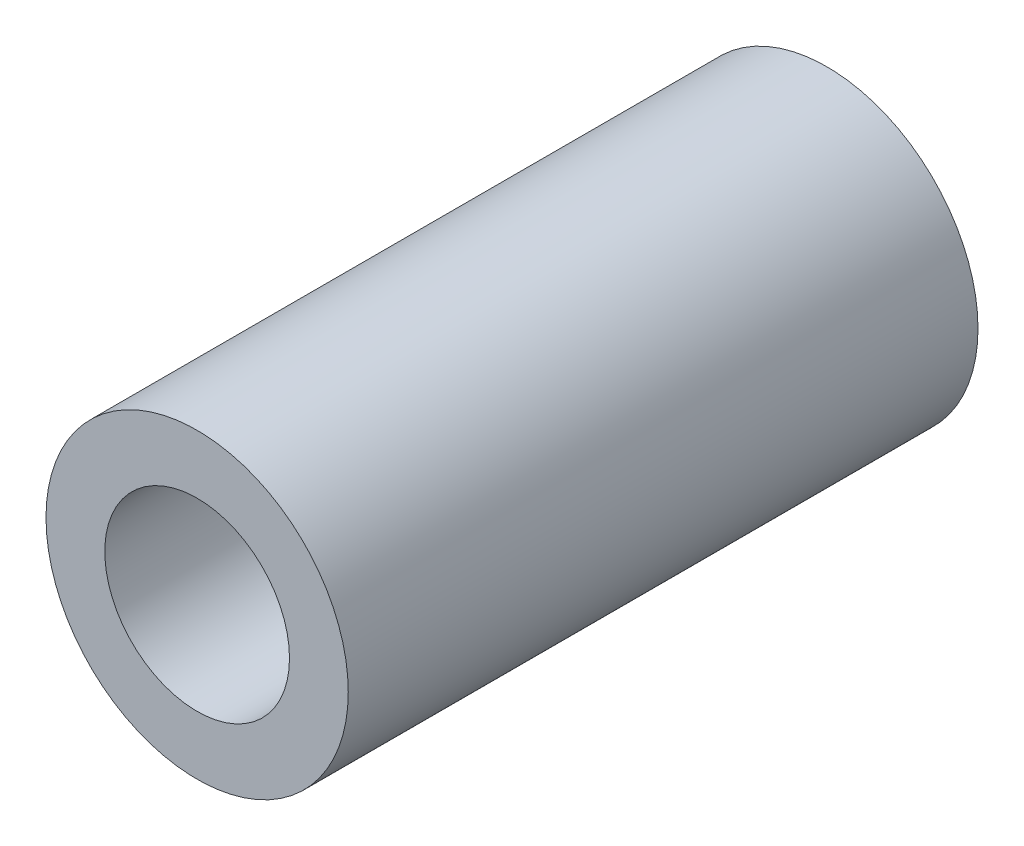
from build123d import *

# Parameters (mm, degrees)
SKETCH1_R           = 1.8
SKETCH1_R_2         = 1.1
BOSS_EXTRUDE1_DEPTH = 3.75


with BuildPart() as part:
    # Sketch1 → Boss-Extrude1 (new, symmetric)
    with BuildSketch(Plane.XY):
        Circle(SKETCH1_R)
        Circle(SKETCH1_R_2, mode=Mode.SUBTRACT)
    extrude(amount=BOSS_EXTRUDE1_DEPTH, both=True)


solid = part.part
